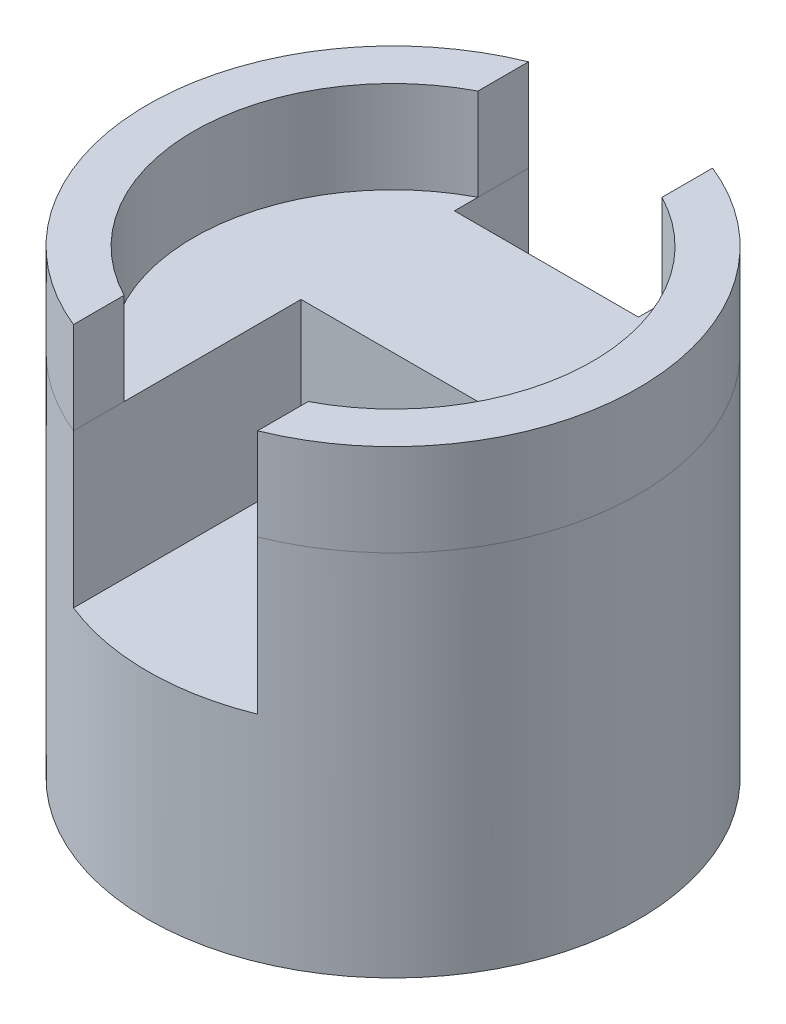
from build123d import *

# Parameters (mm, degrees)
SKETCH2_R           = 101.6
BOSS_EXTRUDE1_DEPTH = 152.4
SKETCH3_R           = 101.6
SKETCH3_R_2         = 82.55
BOSS_EXTRUDE2_DEPTH = 38.1
SKETCH4_W           = 76.2
SKETCH4_H           = 101.6
CUT_EXTRUDE1_DEPTH  = 101.6
SKETCH5_W           = 76.2
SKETCH5_H           = 38.1
CUT_EXTRUDE2_DEPTH  = 239.611336696


with BuildPart() as part:
    # Sketch2 → Boss-Extrude1 (new body)
    with BuildSketch(Plane(origin=(0, 0, 0), x_dir=(1, 0, 0), z_dir=(0, 1, 0))):
        Circle(SKETCH2_R)
    extrude(amount=BOSS_EXTRUDE1_DEPTH)


with BuildPart() as body_2:
    # Sketch3 → Boss-Extrude2 (new body)
    with BuildSketch(Plane(origin=(0, 152.4, 0), x_dir=(1, 0, 0), z_dir=(0, 1, 0))):
        Circle(SKETCH3_R)
        Circle(SKETCH3_R_2, mode=Mode.SUBTRACT)
    extrude(amount=BOSS_EXTRUDE2_DEPTH)


with BuildPart() as cut_extrude1_tool:
    # Sketch4 → Cut-Extrude1 (new body)
    with BuildSketch(Plane(origin=(0, 190.5, 0), x_dir=(1, 0, 0), z_dir=(0, 1, 0))):
        with Locations((0, -50.8)):
            Rectangle(SKETCH4_W, SKETCH4_H)
    extrude(amount=-CUT_EXTRUDE1_DEPTH)


with BuildPart() as part_1:
    add(part.part)

    # Cut-Extrude1: cut by cut_extrude1_tool
    add(cut_extrude1_tool.part, mode=Mode.SUBTRACT)


with BuildPart() as body_2_1:
    add(body_2.part)

    # Cut-Extrude1: cut by cut_extrude1_tool
    add(cut_extrude1_tool.part, mode=Mode.SUBTRACT)


with BuildPart() as cut_extrude2_tool:
    # Sketch5 → Cut-Extrude2 (new, through all)
    with BuildSketch(Plane(origin=(0, 190.5, 0), x_dir=(1, 0, 0), z_dir=(0, 1, 0))):
        with Locations((0, 82.55)):
            Rectangle(SKETCH5_W, SKETCH5_H)
    extrude(amount=-CUT_EXTRUDE2_DEPTH)


with BuildPart() as part_2:
    add(part_1.part)

    # Cut-Extrude2: cut by cut_extrude2_tool
    add(cut_extrude2_tool.part, mode=Mode.SUBTRACT)


with BuildPart() as body_2_2:
    add(body_2_1.part)

    # Cut-Extrude2: cut by cut_extrude2_tool
    add(cut_extrude2_tool.part, mode=Mode.SUBTRACT)


solid = Compound([part_2.part, body_2_2.part])
